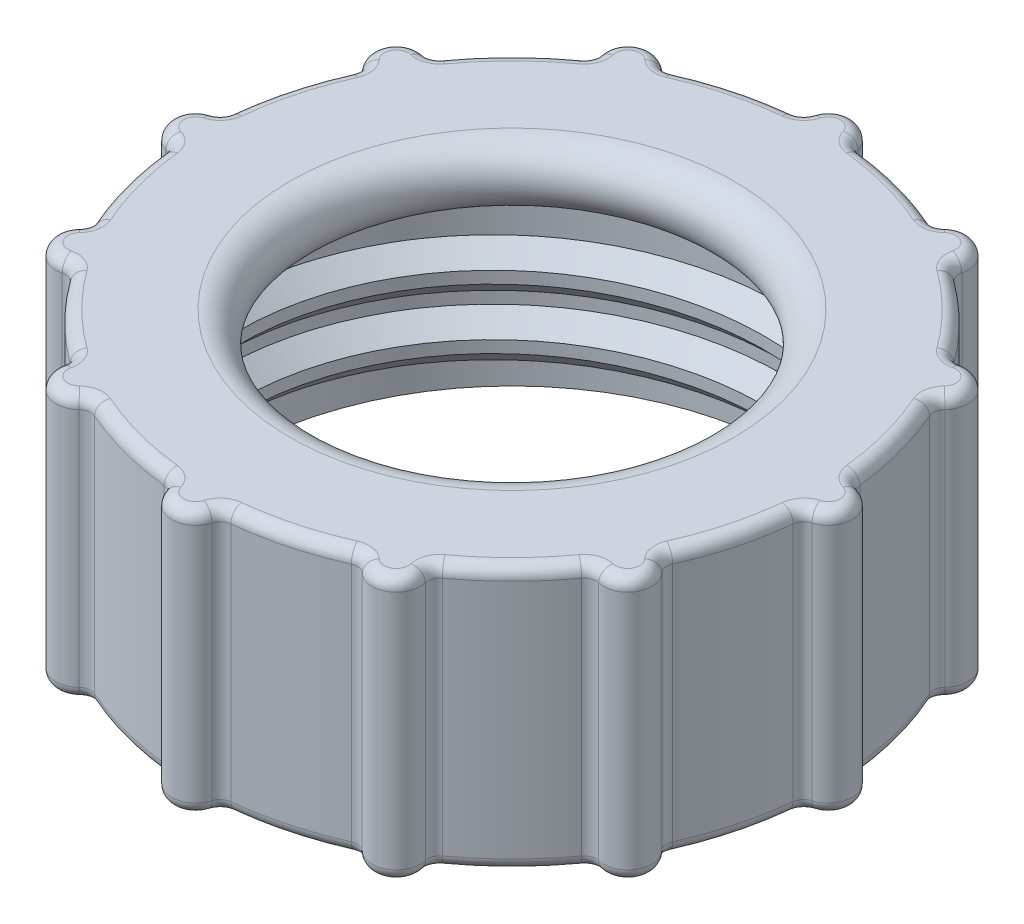
from build123d import *

# Parameters (mm, degrees)
SWEEP_2_PITCH            = 5
EXTRUDE_START            = -22
EXTRUDE_1_DEPTH          = 22
PATTERN_CIRCULAR_1_COUNT = 12
FILLET_1_R               = 1
FILLET_2_R               = 1


with BuildPart() as part:
    # 草图1 → 旋转1 (revolve)
    with BuildSketch(Plane.XY, mode=Mode.PRIVATE) as revolve_1_sk:
        with BuildLine():
            Line((-21.3, 2), (-18.462177826, 2))
            ThreePointArc((-18.462177826, 2), (-15.962177826, 4.5), (-18.462177826, 7))
            Line((-18.462177826, 7), (-23.3, 7))
            Line((-23.3, 7), (-26.3, 7))
            Line((-26.3, 7), (-26.3, -15))
            Line((-26.3, -15), (-23.3, -15))
            Line((-23.3, -15), (-23.3, 0))
            Line((-23.3, 0), (-21.3, 2))
        make_face()
    revolve(revolve_1_sk.sketch.rotate(Axis((0, -5338.803894625, 0), (0, 1, 0)), 180), axis=Axis((0, -5338.803894625, 0), (0, 1, 0)))

    # 扫描2: the profile of 草图3 profile screwed along a right-hand helix of 2 turns, 12 arcs to a turn; built about Z, then put on its axis
    sweep_2_z = Axis((0, 0, 0), (0, 0, 1))
    sweep_2_corners = [(23.3003, 0, -2.0003), (23.3003, 0, 2.0003), (21.8, 0, 0.5), (21.8, 0, -0.5)]
    with BuildLine(mode=Mode.PRIVATE) as sweep_2_profile:
        Line(sweep_2_corners[0], sweep_2_corners[1])
        Line(sweep_2_corners[1], sweep_2_corners[2])
        Line(sweep_2_corners[2], sweep_2_corners[3])
        Line(sweep_2_corners[3], sweep_2_corners[0])
    sweep_2_cap = Face(sweep_2_profile.wire())
    sweep_2_turn_angles = [0, 15, 30, 45, 60, 75, 90, 105, 120, 135, 150, 165, 180, 195, 210, 225, 240, 255, 270, 285, 300, 315, 330, 345, 360]
    sweep_2_turn_weights = [1, 0.9659258262890683, 1, 0.9659258262890683, 1, 0.9659258262890683, 1, 0.9659258262890683, 1, 0.9659258262890683, 1, 0.9659258262890683, 1, 0.9659258262890683, 1, 0.9659258262890683, 1, 0.9659258262890683, 1, 0.9659258262890683, 1, 0.9659258262890683, 1, 0.9659258262890683, 1]
    sweep_2_turn_rails = [Edge.make_bspline([Vector(p[0], p[1], 0).rotate(sweep_2_z, sweep_2_turn_angles[k]) / sweep_2_turn_weights[k] + Vector(0, 0, p[2] + SWEEP_2_PITCH * sweep_2_turn_angles[k] / 360) for k in range(25)], [0, 0, 0, 1, 1, 2, 2, 3, 3, 4, 4, 5, 5, 6, 6, 7, 7, 8, 8, 9, 9, 10, 10, 11, 11, 12, 12, 12], 2, sweep_2_turn_weights) for p in sweep_2_corners]
    sweep_2_turn_sides = [Face.make_surface_from_curves(sweep_2_turn_rails[p[0]], sweep_2_turn_rails[p[1]]) for p in [(0, 1), (1, 2), (2, 3), (3, 0)]]
    sweep_2 = Plane(origin=(0, -13, 0), x_dir=(1, 0, 0), z_dir=(0, 1, 0)) * Solid(Shell([*[p.moved(Location((0, 0, SWEEP_2_PITCH * i))) for i in range(2) for p in sweep_2_turn_sides], sweep_2_cap, sweep_2_cap.rotate(sweep_2_z, 720).moved(Location((0, 0, SWEEP_2_PITCH * 720 / 360)))]))
    add(sweep_2)

    # 草图7 → 凸台-拉伸1 (add)
    with BuildSketch(Plane(origin=(0, 7, 0), x_dir=(1, 0, 0), z_dir=(0, 1, 0)).offset(EXTRUDE_START)):
        with BuildLine():
            ThreePointArc((-1.918454327, 26.865272497), (-2.237349514, 26.37981047), (-2.772271912, 26.153479853))
            ThreePointArc((-2.772271912, 26.153479853), (0, 26.3), (2.772271912, 26.153479853))
            ThreePointArc((2.772271912, 26.153479853), (2.237349514, 26.37981047), (1.918454327, 26.865272497))
            ThreePointArc((1.918454327, 26.865272497), (0, 28.3), (-1.918454327, 26.865272497))
        make_face()
    extrude_1 = extrude(amount=EXTRUDE_1_DEPTH)

    # 阵列(圆周)1: 凸台-拉伸1 ×12 about axis
    pattern_circular_1_axis = Axis((0, 0, 0), (0, 1, 0))
    for i in range(1, PATTERN_CIRCULAR_1_COUNT):
        add(extrude_1.rotate(pattern_circular_1_axis, i * 360 / PATTERN_CIRCULAR_1_COUNT))

    # 圆角1
    fillet_1_edges = [part.edges().sort_by_distance(p)[0] for p in [
        (-6.806940886, 7, 25.403849231),
        (-2.237349514, 7, 26.37981047),
        (2.237349514, 7, 26.37981047),
        (0, 7, 28.3),
        (-18.596908345, 7, 18.596908345),
        (-15.127506751, 7, 21.726911257),
        (-11.252303719, 7, 23.964260771),
        (-14.15, 7, 24.508518927),
        (-25.403849231, 7, 6.806940886),
        (-23.964260771, 7, 11.252303719),
        (-21.726911257, 7, 15.127506751),
        (-24.508518927, 7, 14.15),
        (-25.403849231, 7, -6.806940886),
        (-26.37981047, 7, -2.237349514),
        (-26.37981047, 7, 2.237349514),
        (-28.3, 7, 0),
        (-18.596908345, 7, -18.596908345),
        (-21.726911257, 7, -15.127506751),
        (-23.964260771, 7, -11.252303719),
        (-24.508518927, 7, -14.15),
        (-6.806940886, 7, -25.403849231),
        (-11.252303719, 7, -23.964260771),
        (-15.127506751, 7, -21.726911257),
        (-14.15, 7, -24.508518927),
        (6.806940886, 7, -25.403849231),
        (2.237349514, 7, -26.37981047),
        (-2.237349514, 7, -26.37981047),
        (0, 7, -28.3),
        (18.596908345, 7, -18.596908345),
        (15.127506751, 7, -21.726911257),
        (11.252303719, 7, -23.964260771),
        (14.15, 7, -24.508518927),
        (25.403849231, 7, -6.806940886),
        (23.964260771, 7, -11.252303719),
        (21.726911257, 7, -15.127506751),
        (24.508518927, 7, -14.15),
        (25.403849231, 7, 6.806940886),
        (26.37981047, 7, 2.237349514),
        (26.37981047, 7, -2.237349514),
        (28.3, 7, 0),
        (18.596908345, 7, 18.596908345),
        (21.726911257, 7, 15.127506751),
        (23.964260771, 7, 11.252303719),
        (24.508518927, 7, 14.15),
        (6.806940886, 7, 25.403849231),
        (11.252303719, 7, 23.964260771),
        (15.127506751, 7, 21.726911257),
        (14.15, 7, 24.508518927),
    ]]
    fillet(fillet_1_edges, radius=FILLET_1_R)

    # 圆角2
    fillet_2_edges = [part.edges().sort_by_distance(p)[0] for p in [
        (-6.806940886, -15, 25.403849231),
        (-2.237349514, -15, 26.37981047),
        (2.237349514, -15, 26.37981047),
        (0, -15, 28.3),
        (-18.596908345, -15, 18.596908345),
        (-15.127506751, -15, 21.726911257),
        (-11.252303719, -15, 23.964260771),
        (-14.15, -15, 24.508518927),
        (-25.403849231, -15, 6.806940886),
        (-23.964260771, -15, 11.252303719),
        (-21.726911257, -15, 15.127506751),
        (-24.508518927, -15, 14.15),
        (-25.403849231, -15, -6.806940886),
        (-26.37981047, -15, -2.237349514),
        (-26.37981047, -15, 2.237349514),
        (-28.3, -15, 0),
        (-18.596908345, -15, -18.596908345),
        (-21.726911257, -15, -15.127506751),
        (-23.964260771, -15, -11.252303719),
        (-24.508518927, -15, -14.15),
        (-6.806940886, -15, -25.403849231),
        (-11.252303719, -15, -23.964260771),
        (-15.127506751, -15, -21.726911257),
        (-14.15, -15, -24.508518927),
        (6.806940886, -15, -25.403849231),
        (2.237349514, -15, -26.37981047),
        (-2.237349514, -15, -26.37981047),
        (0, -15, -28.3),
        (18.596908345, -15, -18.596908345),
        (15.127506751, -15, -21.726911257),
        (11.252303719, -15, -23.964260771),
        (14.15, -15, -24.508518927),
        (25.403849231, -15, -6.806940886),
        (23.964260771, -15, -11.252303719),
        (21.726911257, -15, -15.127506751),
        (24.508518927, -15, -14.15),
        (25.403849231, -15, 6.806940886),
        (26.37981047, -15, 2.237349514),
        (26.37981047, -15, -2.237349514),
        (28.3, -15, 0),
        (18.596908345, -15, 18.596908345),
        (21.726911257, -15, 15.127506751),
        (23.964260771, -15, 11.252303719),
        (24.508518927, -15, 14.15),
        (6.806940886, -15, 25.403849231),
        (11.252303719, -15, 23.964260771),
        (15.127506751, -15, 21.726911257),
        (14.15, -15, 24.508518927),
    ]]
    fillet(fillet_2_edges, radius=FILLET_2_R)


solid = part.part
